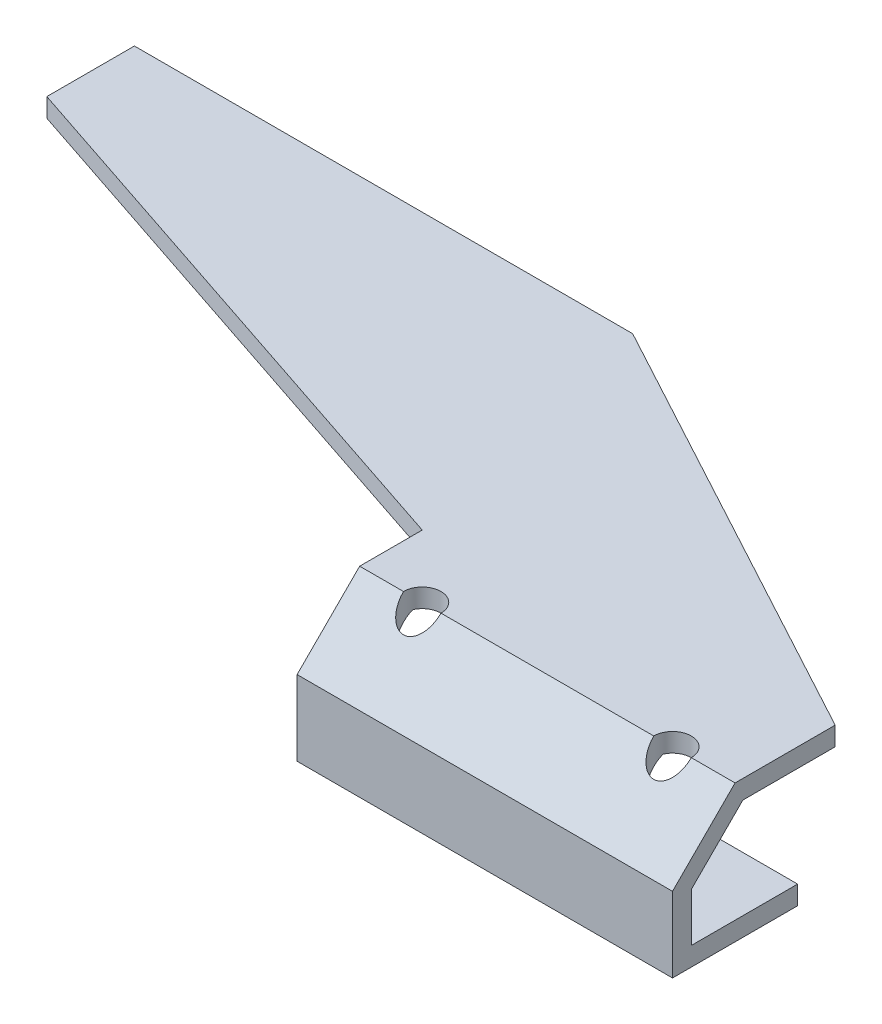
from build123d import *

# Parameters (mm, degrees)
BOSS_EXTRUDE1_DEPTH     = 150
CUT_EXTRUDE5_DEPTH      = 172.417618698
CUT_EXTRUDE5_DEPTH_BACK = 172.417618698
CUT_EXTRUDE6_REACH      = 173.418
SKETCH3_R               = 1.6
SKETCH4_R               = 3
CUT_EXTRUDE7_DEPTH      = 172.058469536
CUT_EXTRUDE8_REACH      = 173.418
SKETCH5_R               = 5


with BuildPart() as part:
    # Sketch1 → Boss-Extrude1 (new body)
    with BuildSketch(Plane(origin=(0, 0, 0), x_dir=(0, 0, -1), z_dir=(1, 0, 0))):
        Polygon((20, 0), (0, 0), (0, 12), (10, 22), (64, 22), (80, 6), (80, -14), (77, -14), (77, 4.757359313), (62.757359313, 19), (11.242640687, 19), (3, 10.757359313), (3, 3), (20, 3), align=None)
    extrude(amount=-BOSS_EXTRUDE1_DEPTH)

    # Sketch2 → Cut-Extrude5 (cut, two sides: drawn at the far end of the back side and taken through both)
    with BuildSketch(Plane(origin=(0, 0, 0), x_dir=(1, 0, 0), z_dir=(0, 1, 0)).offset(-CUT_EXTRUDE5_DEPTH_BACK)):
        Polygon((-100, 80), (0, 26), (0, 80), align=None)
        Polygon((-150, 0), (-60, 0), (-60, 20), (-150, 50), align=None)
    extrude(amount=CUT_EXTRUDE5_DEPTH + CUT_EXTRUDE5_DEPTH_BACK, mode=Mode.SUBTRACT)

    # Sketch3 → Cut-Extrude6 (cut, up to next)
    with BuildSketch(Plane.XZ, mode=Mode.PRIVATE) as cut_extrude6_sk1:
        with Locations((-50, -10)):
            Circle(SKETCH3_R)
    cut_extrude6_tool1 = extrude(cut_extrude6_sk1.sketch, amount=-CUT_EXTRUDE6_REACH, mode=Mode.PRIVATE) & part.part
    # Sketch3 → Cut-Extrude6 (cut, up to next)
    with BuildSketch(Plane.XZ, mode=Mode.PRIVATE) as cut_extrude6_sk2:
        with Locations((-10, -10)):
            Circle(SKETCH3_R)
    cut_extrude6_tool2 = extrude(cut_extrude6_sk2.sketch, amount=-CUT_EXTRUDE6_REACH, mode=Mode.PRIVATE) & part.part
    add(cut_extrude6_tool1.solids().sort_by_distance((-50, 0, -10))[0], mode=Mode.SUBTRACT)
    add(cut_extrude6_tool2.solids().sort_by_distance((-10, 0, -10))[0], mode=Mode.SUBTRACT)

    # Sketch4 → Cut-Extrude7 (cut, through all)
    with BuildSketch(Plane(origin=(0, 3, 0), x_dir=(1, 0, 0), z_dir=(0, 1, 0))):
        with Locations((-50, 10)):
            Circle(SKETCH4_R)
        with Locations((-10, 10)):
            Circle(SKETCH4_R)
    extrude(amount=CUT_EXTRUDE7_DEPTH, mode=Mode.SUBTRACT)

    # Sketch5 → Cut-Extrude8 (cut, up to next)
    with BuildSketch(Plane.XZ, mode=Mode.PRIVATE) as cut_extrude8_sk1:
        with Locations((-30, -10)):
            Circle(SKETCH5_R)
    cut_extrude8_tool1 = extrude(cut_extrude8_sk1.sketch, amount=-CUT_EXTRUDE8_REACH, mode=Mode.PRIVATE) & part.part
    add(cut_extrude8_tool1.solids().sort_by_distance((-30, 0, -10))[0], mode=Mode.SUBTRACT)


solid = part.part
